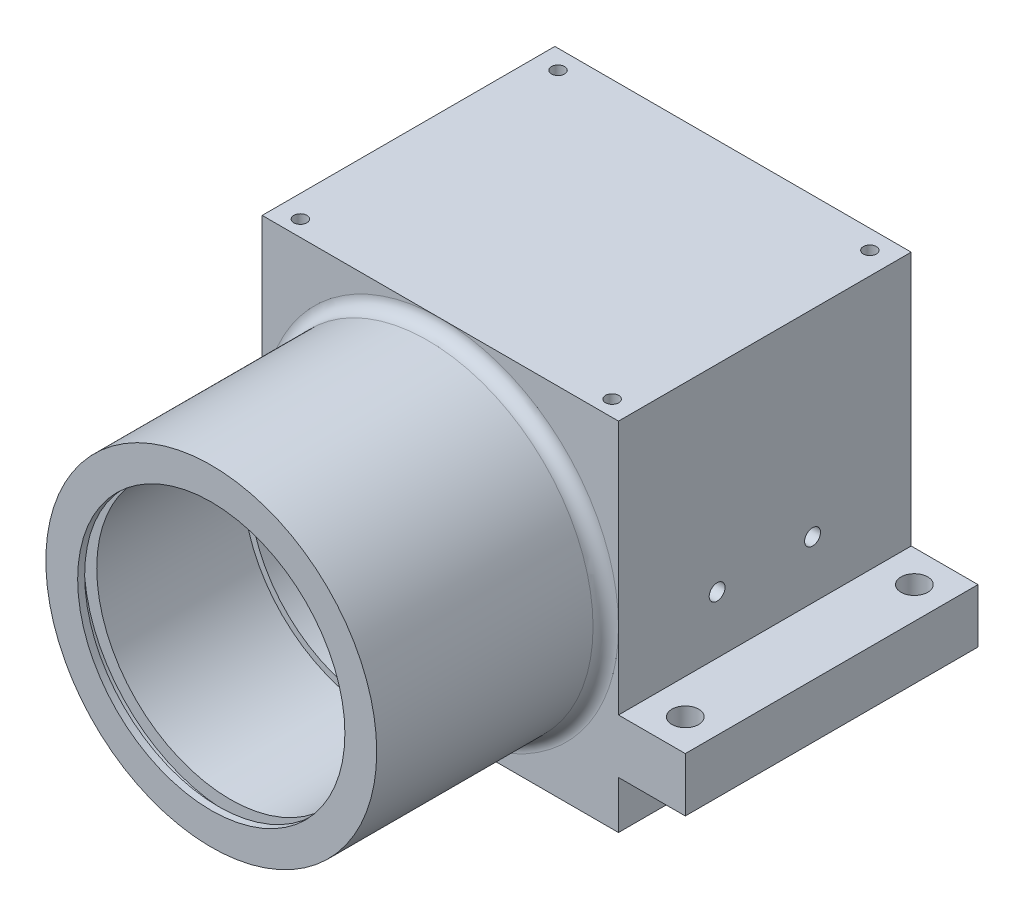
from build123d import *

# Parameters (mm, degrees)
SKETCH_1_W                  = 56
SKETCH_1_H                  = 56
EXTRUDE_1_DEPTH             = 82
SKETCH_4_W                  = 56
SKETCH_4_H                  = 56
SKETCH_4_R                  = 26
CUT_EXTRUDE_1_DEPTH         = 36
HOLE_WIZARD_M4_1_D          = 3.3
HOLE_WIZARD_M4_1_DEPTH      = 10.1
HOLE_WIZARD_M4_1_TIP        = 0.991420021
SKETCH_15_W                 = 23
SKETCH_15_H                 = 1.9
FILLET_1_R                  = 2
CHAMFER_2_SIZE              = 1
HOLE_WIZARD_M2_5_1_D        = 2.05
HOLE_WIZARD_M2_5_1_DEPTH    = 7.25
HOLE_WIZARD_M2_5_1_TIP      = 0.615882135
SKETCH_19_W                 = 10.5
SKETCH_19_H                 = 46
EXTRUDE_2_DEPTH             = 16
HOLE_WIZARD_M5_1_D          = 4.2
HOLE_WIZARD_M3_1_AT_2_COUNT = 2
HOLE_WIZARD_M3_1_AT_2_PITCH = 15
CUT_EXTRUDE_2_REACH         = 96.817
SKETCH_25_W                 = 10.5
SKETCH_25_H                 = 7.5


with BuildPart() as part:
    # 草图1 → 凸台-拉伸1 (new body)
    with BuildSketch(Plane.XY):
        Rectangle(SKETCH_1_W, SKETCH_1_H)
    extrude(amount=EXTRUDE_1_DEPTH)

    # 草图3 → 切除-旋转2 (revolve, cut)
    with BuildSketch(Plane(origin=(0, 0, 0), x_dir=(0, 0, -1), z_dir=(1, 0, 0)), mode=Mode.PRIVATE) as cut_revolve_2_sk:
        Polygon((-82, 0), (0, 0), (0, 23), (-52, 23), (-52, 20), (-56, 20), (-56, 21), (-82, 21), align=None)
    revolve(cut_revolve_2_sk.sketch.rotate(Axis((0, 0, -5.719261836), (0, 0, 1)), 90), axis=Axis((0, 0, -5.719261836), (0, 0, 1)), mode=Mode.SUBTRACT)

    # 草图4 → 切除-拉伸1 (cut)
    with BuildSketch(Plane.XY.offset(82)):
        Rectangle(SKETCH_4_W, SKETCH_4_H)
        Circle(SKETCH_4_R, mode=Mode.SUBTRACT)
    extrude(amount=-CUT_EXTRUDE_1_DEPTH, mode=Mode.SUBTRACT)

    # M4 螺纹孔1
    with Locations(Plane(origin=(0, 0, 0), x_dir=(-1, 0, 0), z_dir=(0, 0, -1))):
        with Locations((18.384776311, 18.384776311), (18.384776311, -18.384776311), (-18.384776311, -18.384776311), (-18.384776311, 18.384776311)):
            Hole(HOLE_WIZARD_M4_1_D / 2, depth=HOLE_WIZARD_M4_1_DEPTH)
            with Locations((0, 0, -(HOLE_WIZARD_M4_1_DEPTH + HOLE_WIZARD_M4_1_TIP / 2))):  # 118° drill point
                Cone(0, HOLE_WIZARD_M4_1_D / 2, HOLE_WIZARD_M4_1_TIP, mode=Mode.SUBTRACT)

    # 草图15 → 切除-旋转3 (revolve, cut)
    with BuildSketch(Plane(origin=(0, 0, 0), x_dir=(1, 0, 0), z_dir=(0, 1, 0))):
        with Locations((-11.5, -79.95)):
            Rectangle(SKETCH_15_W, SKETCH_15_H)
    revolve(axis=Axis((0, 0, 0), (0, 0, 1)), mode=Mode.SUBTRACT)

    # 圆角1
    fillet_1_edges = [part.edges().sort_by_distance(p)[0] for p in [
        (-26, 0, 46),
    ]]
    fillet(fillet_1_edges, radius=FILLET_1_R - 0.0001)  # a hair under: the kernel refuses the full size

    # 倒角2
    chamfer_2_edges = [part.edges().sort_by_distance(p)[0] for p in [
        (23, 0, 0),
    ]]
    chamfer(chamfer_2_edges, length=CHAMFER_2_SIZE)

    # M2.5 螺纹孔1
    with Locations(Plane(origin=(0, 28, 0), x_dir=(1, 0, 0), z_dir=(0, 1, 0))):
        with Locations((24.5, -3), (-24.5, -43.5), (-24.5, -3), (24.5, -43.5)):
            Hole(HOLE_WIZARD_M2_5_1_D / 2, depth=HOLE_WIZARD_M2_5_1_DEPTH)
            with Locations((0, 0, -(HOLE_WIZARD_M2_5_1_DEPTH + HOLE_WIZARD_M2_5_1_TIP / 2))):  # 118° drill point
                Cone(0, HOLE_WIZARD_M2_5_1_D / 2, HOLE_WIZARD_M2_5_1_TIP, mode=Mode.SUBTRACT)

    # 草图19 → 凸台-拉伸2 (add)
    with BuildSketch(Plane.XZ.offset(28)):
        with Locations((33.25, 23)):
            Rectangle(SKETCH_19_W, SKETCH_19_H)
        with Locations((-33.25, 23)):
            Rectangle(SKETCH_19_W, SKETCH_19_H)
    extrude(amount=-EXTRUDE_2_DEPTH)

    # M5 螺纹孔1 (through all)
    with Locations(Plane(origin=(0, -28, 0), x_dir=(-1, 0, 0), z_dir=(0, -1, 0))):
        with Locations((33.5, -5), (-33.5, -41), (-33.5, -5), (33.5, -41)):
            Hole(HOLE_WIZARD_M5_1_D / 2)

    # 草图24 → M3 螺纹孔1 (revolve, cut)
    with BuildSketch(Plane(origin=(28, -3, 30.5), x_dir=(0, 0, -1), z_dir=(0, 1, 0))):
        Polygon((0, 0), (0, 6.251075774), (1.25, 5.5), (1.25, 0), align=None)
    hole_wizard_m3_1 = revolve(axis=Axis((34.35, -3, 30.5), (-1, 0, 0)), mode=Mode.SUBTRACT)

    # M3 螺纹孔1 at 2: M3 螺纹孔1 ×2
    with Locations(*[(0, 0, -i * HOLE_WIZARD_M3_1_AT_2_PITCH) for i in range(1, HOLE_WIZARD_M3_1_AT_2_COUNT)]):
        add(hole_wizard_m3_1, mode=Mode.SUBTRACT)

    # 草图25 → 切除-拉伸2 (cut, up to next)
    with BuildSketch(Plane(origin=(0, 0, 0), x_dir=(-1, 0, 0), z_dir=(0, 0, -1)), mode=Mode.PRIVATE) as cut_extrude_2_sk1:
        with Locations((-33.25, -24.25)):
            Rectangle(SKETCH_25_W, SKETCH_25_H)
    cut_extrude_2_tool1 = extrude(cut_extrude_2_sk1.sketch, amount=-CUT_EXTRUDE_2_REACH, mode=Mode.PRIVATE) & part.part
    cut_extrude_2 = cut_extrude_2_tool1.solids().sort_by_distance((33.25, -24.25, 0))[0]
    add(cut_extrude_2, mode=Mode.SUBTRACT)

    # 镜向1: M3 螺纹孔1, 切除-拉伸2 across plane
    add(hole_wizard_m3_1.mirror(Plane(origin=(0, 0, 0), x_dir=(0, 0, 1), z_dir=(1, 0, 0))), mode=Mode.SUBTRACT)
    add(cut_extrude_2.mirror(Plane(origin=(0, 0, 0), x_dir=(0, 0, 1), z_dir=(1, 0, 0))), mode=Mode.SUBTRACT)

    # 镜向1 copy 1 sketch → 镜向1 copy 1 (revolve, cut)
    with BuildSketch(Plane(origin=(-28, -3, 15.5), x_dir=(0, 0, -1), z_dir=(0, 1, 0))):
        Polygon((0, 0), (0, -6.251075774), (1.25, -5.5), (1.25, 0), align=None)
    revolve(axis=Axis((-34.35, -3, 15.5), (-1, 0, 0)), mode=Mode.SUBTRACT)


solid = part.part
